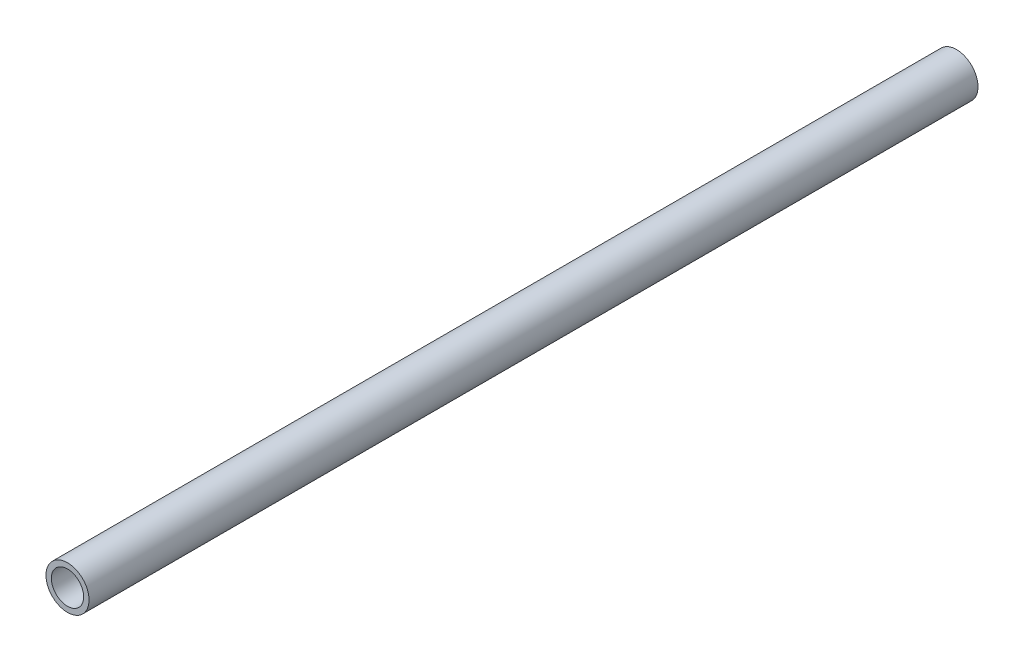
from build123d import *

# Parameters (mm, degrees)
SKETCH2_R           = 40
SKETCH2_R_2         = 30
BOSS_EXTRUDE1_DEPTH = 1651


with BuildPart() as part:
    # Sketch2 → Boss-Extrude1 (new body)
    with BuildSketch(Plane.XY):
        Circle(SKETCH2_R)
        Circle(SKETCH2_R_2, mode=Mode.SUBTRACT)
    extrude(amount=BOSS_EXTRUDE1_DEPTH)


solid = part.part
